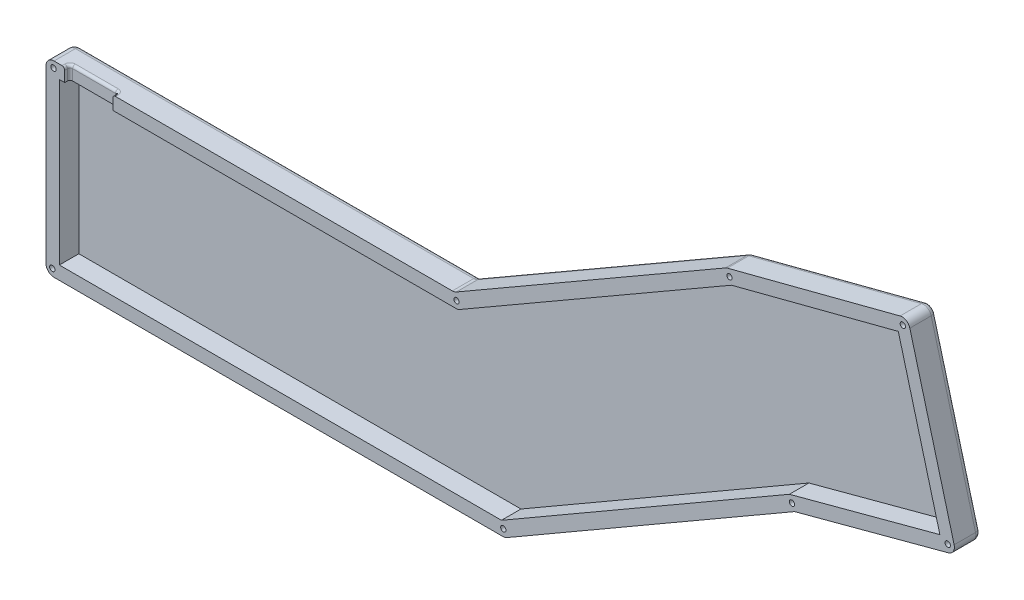
from build123d import *

# Parameters (mm, degrees)
BOSS_EXTRU_1_DEPTH      = 10
CONG_1_R                = 3
BOSS_EXTRU_2_DEPTH      = 2.7
CONG_2_R                = 2
ESQUISSE3_R             = 1
ENL_V_MAT_EXTRU_1_DEPTH = 20
ESQUISSE4_R             = 2
ENL_V_MAT_EXTRU_2_DEPTH = 2
ENL_V_MAT_EXTRU_3_DEPTH = 10
CONG_3_R                = 1


with BuildPart() as part:
    # Model → Boss.-Extru.1 (new body)
    with BuildSketch(Plane.XY):
        Polygon((75.33141454, 71.077500491), (-26.464533767, 12.30154537), (-179.373873722, 12.291034855), (-179.373873722, -50.687645053), (-179.373873722, -57.858487698), (-7.520422715, -57.858487698), (100.854480283, 4.809102496), (161.383942986, 21.020985262), (143.246352653, 88.745859712), align=None)
        Polygon((-174.373873722, 7.291378528), (-25.124548608, 7.301637465), (77.245358051, 66.408990356), (139.700811798, 82.657041562), (155.26069475, 24.557200291), (98.923133978, 9.468053786), (-8.861972593, -52.858487698), (-174.373873722, -52.858487698), (-174.373873722, -50.687645053), align=None, mode=Mode.SUBTRACT)
    extrude(amount=BOSS_EXTRU_1_DEPTH)

    # Congé1
    cong_1_edges = [part.edges().sort_by_distance(p)[0] for p in [
        (-26.464533767, 12.30154537, 5),
        (75.33141454, 71.077500491, 5),
        (143.246352653, 88.745859712, 5),
        (161.383942986, 21.020985262, 5),
        (100.854480283, 4.809102496, 5),
        (-7.520422715, -57.858487698, 5),
        (-179.373873722, -57.858487698, 5),
        (-179.373873722, 12.291034855, 5),
    ]]
    fillet(cong_1_edges, radius=CONG_1_R)

    # Esquisse1 → Boss.-Extru.2 (add)
    with BuildSketch(Plane.XY):
        Polygon((-25.124548608, 7.301637465), (-174.373873722, 7.291378528), (-174.373873722, -50.687645053), (-174.373873722, -52.858487698), (-8.861972593, -52.858487698), (98.923133978, 9.468053786), (155.26069475, 24.557200291), (139.700811798, 82.657041562), (77.245358051, 66.408990356), align=None)
    extrude(amount=BOSS_EXTRU_2_DEPTH)

    # Congé2
    cong_2_edges = [part.edges().sort_by_distance(p)[0] for p in [
        (100.86445313, 4.78504518, 0),
        (46.843967712, -26.422377988, 0),
        (-7.547920203, -57.756003669, 0),
        (-92.349613182, -57.858487698, 0),
        (-178.495194066, -56.979808041, 0),
        (-179.373873722, -22.78362332, 0),
        (-178.495266971, 11.412488494, 0),
        (-101.821199292, 12.296365586, 0),
        (-26.491925042, 12.40375087, 0),
        (24.605627892, 41.788942262, 0),
        (75.341794938, 71.05218052, 0),
        (108.044083383, 79.587840046, 0),
        (142.628648998, 87.685066626, 0),
        (152.312387337, 54.893729991, 0),
        (160.307894606, 21.642410085, 0),
        (129.861641055, 12.578223, 0),
    ]]
    fillet(cong_2_edges, radius=CONG_2_R)

    # Esquisse3 → Enlèv. mat.-Extru.1 (cut)
    with BuildSketch(Plane.XY):
        with Locations((158.201617013, 22.958080812)):
            Circle(ESQUISSE3_R)
        with Locations((141.388472611, 85.534334234)):
            Circle(ESQUISSE3_R)
        with Locations((76.500226548, 68.776582274)):
            Circle(ESQUISSE3_R)
        with Locations((99.890442316, 7.071415488)):
            Circle(ESQUISSE3_R)
        with Locations((-8.172352823, -55.275906246)):
            Circle(ESQUISSE3_R)
        with Locations((-25.691359515, 9.920090126)):
            Circle(ESQUISSE3_R)
        with Locations((-176.562127678, 9.920090126)):
            Circle(ESQUISSE3_R)
        with Locations((-177.029598341, -55.275906246)):
            Circle(ESQUISSE3_R)
    extrude(amount=ENL_V_MAT_EXTRU_1_DEPTH, mode=Mode.SUBTRACT)

    # Esquisse4 → Enlèv. mat.-Extru.2 (cut)
    with BuildSketch(Plane(origin=(0, 0, 0), x_dir=(-1, 0, 0), z_dir=(0, 0, -1))):
        with Locations((177.029598341, -55.275906246)):
            Circle(ESQUISSE4_R)
        with Locations((176.562127678, 9.920090126)):
            Circle(ESQUISSE4_R)
        with Locations((25.691359515, 9.920090126)):
            Circle(ESQUISSE4_R)
        with Locations((-76.500226548, 68.776582274)):
            Circle(ESQUISSE4_R)
        with Locations((-141.388472611, 85.534334234)):
            Circle(ESQUISSE4_R)
        with Locations((-158.201617013, 22.958080812)):
            Circle(ESQUISSE4_R)
        with Locations((-99.890442316, 7.071415488)):
            Circle(ESQUISSE4_R)
        with Locations((8.172352823, -55.275906246)):
            Circle(ESQUISSE4_R)
    extrude(amount=-ENL_V_MAT_EXTRU_2_DEPTH, mode=Mode.SUBTRACT)

    # Esquisse5 → Enlèv. mat.-Extru.3 (cut)
    with BuildSketch(Plane(origin=(-0.000845695, 12.303364402, 0), x_dir=(0.9999999976376189, 6.873690724146591e-05, 0), z_dir=(-6.873690724146591e-05, 0.9999999976376189, 0))):
        with BuildLine():
            Line((-171.373234654, -8), (-155.373234654, -8))
            ThreePointArc((-155.373234654, -8), (-154.666127873, -8.292893219), (-154.373234654, -9))
            Line((-154.373234654, -9), (-154.373234654, -18))
            Line((-154.373234654, -18), (-172.373234654, -18))
            Line((-172.373234654, -18), (-172.373234654, -9))
            ThreePointArc((-172.373234654, -9), (-172.080341436, -8.292893219), (-171.373234654, -8))
        make_face()
    extrude(amount=-ENL_V_MAT_EXTRU_3_DEPTH, mode=Mode.SUBTRACT)

    # Congé3
    cong_3_edges = [part.edges().sort_by_distance(p)[0] for p in [
        (-154.374079985, 12.292753263, 9.5),
        (-154.666973203, 12.292733131, 8.292893219),
        (-172.374079942, 12.291515999, 9.5),
        (-172.081186724, 12.291536132, 8.292893219),
        (-163.374079964, 12.292134631, 8),
    ]]
    fillet(cong_3_edges, radius=CONG_3_R)


solid = part.part
